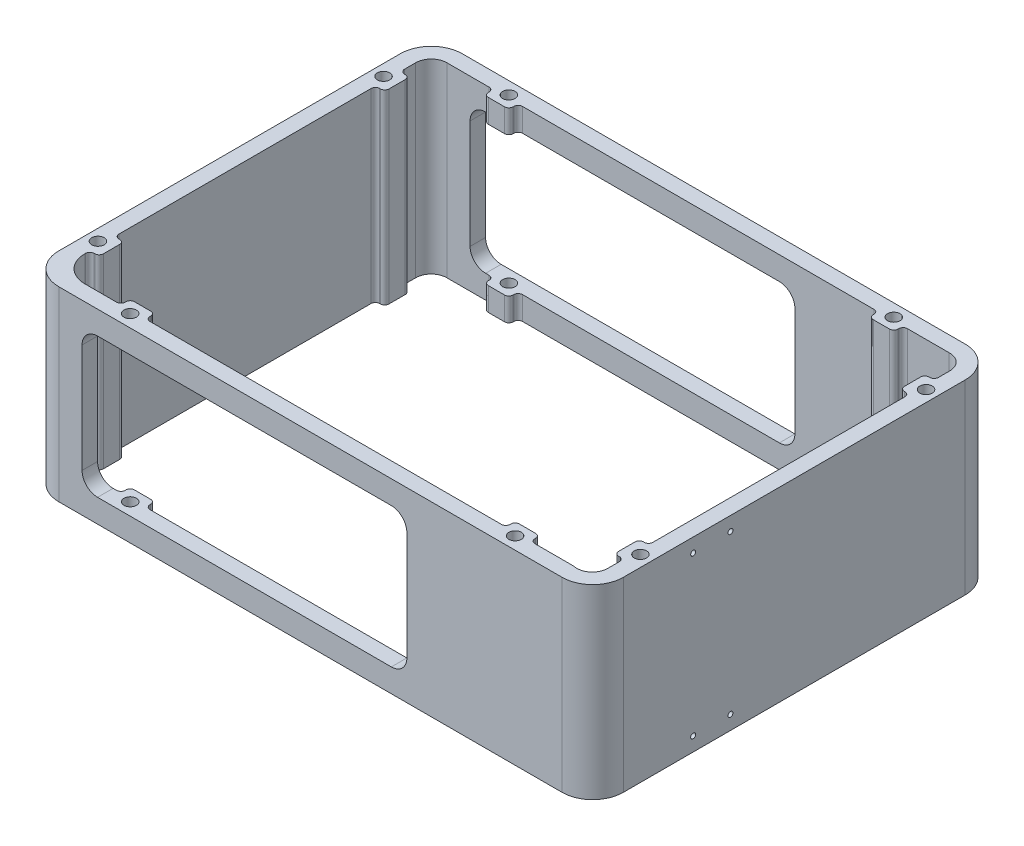
from build123d import *

# Parameters (mm, degrees)
SKETCH1_R           = 2
BOSS_EXTRUDE1_DEPTH = 60
CUT_EXTRUDE1_DEPTH  = 170.649638962
SKETCH3_R           = 0.8
CUT_EXTRUDE2_DEPTH  = 12


with BuildPart() as part:
    # Sketch1 → Boss-Extrude1 (new body)
    with BuildSketch(Plane(origin=(0, 0, 0), x_dir=(1, 0, 0), z_dir=(0, 1, 0))):
        with BuildLine():
            Line((91, 49.75), (91, -5.75))
            Line((91, -5.75), (91, -31.75))
            Line((91, -31.75), (91, -60.381931677))
            ThreePointArc((91, -60.381931677), (88.109485626, -67.360250682), (81.131166621, -70.250765056))
            Line((81.131166621, -70.250765056), (-81, -70.250765056))
            ThreePointArc((-81, -70.250765056), (-88.071067812, -67.321832868), (-91, -60.250765056))
            Line((-91, -60.250765056), (-91, 49.749234944))
            ThreePointArc((-91, 49.749234944), (-88.071067812, 56.820302755), (-81, 59.749234944))
            Line((-81, 59.749234944), (81.12369537, 59.749234944))
            ThreePointArc((81.12369537, 59.749234944), (88.11466632, 56.777198813), (91, 49.75))
        make_face()
        with Locations((-87.380604025, 40.749234944)):
            Circle(SKETCH1_R, mode=Mode.SUBTRACT)
        with Locations((-87.380604025, -51.250765056)):
            Circle(SKETCH1_R, mode=Mode.SUBTRACT)
        with Locations((-62, 55.749234944)):
            Circle(SKETCH1_R, mode=Mode.SUBTRACT)
        with Locations((-62, -66.250765056)):
            Circle(SKETCH1_R, mode=Mode.SUBTRACT)
        with Locations((62, -66.250765056)):
            Circle(SKETCH1_R, mode=Mode.SUBTRACT)
        with Locations((87.380604025, -51.250765056)):
            Circle(SKETCH1_R, mode=Mode.SUBTRACT)
        with Locations((87.380604025, 40.749234944)):
            Circle(SKETCH1_R, mode=Mode.SUBTRACT)
        with Locations((62, 55.749234944)):
            Circle(SKETCH1_R, mode=Mode.SUBTRACT)
        with BuildLine():
            Line((86, 49.75), (86, 46.137408821))
            ThreePointArc((86, 46.137408821), (85.593413285, 45.155821659), (84.611826122, 44.749234944))
            Line((84.611826122, 44.749234944), (84.388173878, 44.749234944))
            ThreePointArc((84.388173878, 44.749234944), (83.406586715, 44.342648228), (83, 43.361061066))
            Line((83, 43.361061066), (83, 38.141941201))
            ThreePointArc((83, 38.141941201), (83.408187843, 37.158755518), (84.392698858, 36.753774698))
            Line((84.392698858, 36.753774698), (84.607301142, 36.754474233))
            ThreePointArc((84.607301142, 36.754474233), (85.591812157, 36.349493414), (86, 35.366307731))
            Line((86, 35.366307731), (86, -5.75))
            Line((86, -5.75), (86, -45.862591179))
            ThreePointArc((86, -45.862591179), (85.593413285, -46.844178341), (84.611826122, -47.250765056))
            Line((84.611826122, -47.250765056), (84.388173878, -47.250765056))
            ThreePointArc((84.388173878, -47.250765056), (83.406586715, -47.657351772), (83, -48.638938934))
            Line((83, -48.638938934), (83, -53.862591179))
            ThreePointArc((83, -53.862591179), (83.406586715, -54.844178341), (84.388173878, -55.250765056))
            Line((84.388173878, -55.250765056), (84.611826122, -55.250765056))
            ThreePointArc((84.611826122, -55.250765056), (85.593413285, -55.657351772), (86, -56.638938934))
            Line((86, -56.638938934), (86, -60.381931677))
            ThreePointArc((86, -60.381931677), (84.107352551, -64.29911946), (79.86225595, -65.250765056))
            Line((79.86225595, -65.250765056), (67.388173878, -65.250765056))
            ThreePointArc((67.388173878, -65.250765056), (66.406586715, -64.844178341), (66, -63.862591179))
            Line((66, -63.862591179), (66, -63.638938934))
            ThreePointArc((66, -63.638938934), (65.593413285, -62.657351772), (64.611826122, -62.250765056))
            Line((64.611826122, -62.250765056), (59.388173878, -62.250765056))
            ThreePointArc((59.388173878, -62.250765056), (58.406586715, -62.657351772), (58, -63.638938934))
            Line((58, -63.638938934), (58, -63.862591179))
            ThreePointArc((58, -63.862591179), (57.593413285, -64.844178341), (56.611826122, -65.250765056))
            Line((56.611826122, -65.250765056), (-56.611826122, -65.250765056))
            ThreePointArc((-56.611826122, -65.250765056), (-57.593413285, -64.844178341), (-58, -63.862591179))
            Line((-58, -63.862591179), (-58, -63.638938934))
            ThreePointArc((-58, -63.638938934), (-58.406586715, -62.657351772), (-59.388173878, -62.250765056))
            Line((-59.388173878, -62.250765056), (-64.611826122, -62.250765056))
            ThreePointArc((-64.611826122, -62.250765056), (-65.593413285, -62.657351772), (-66, -63.638938934))
            Line((-66, -63.638938934), (-66, -63.862591179))
            ThreePointArc((-66, -63.862591179), (-66.406586715, -64.844178341), (-67.388173878, -65.250765056))
            Line((-67.388173878, -65.250765056), (-77.619954017, -65.250765056))
            ThreePointArc((-77.619954017, -65.250765056), (-83.545541358, -62.796306415), (-86, -56.870719073))
            Line((-86, -56.870719073), (-86, -56.638938934))
            ThreePointArc((-86, -56.638938934), (-85.593413285, -55.657351772), (-84.611826122, -55.250765056))
            Line((-84.611826122, -55.250765056), (-84.388173878, -55.250765056))
            ThreePointArc((-84.388173878, -55.250765056), (-83.406586715, -54.844178341), (-83, -53.862591179))
            Line((-83, -53.862591179), (-83, -48.638938934))
            ThreePointArc((-83, -48.638938934), (-83.406586715, -47.657351772), (-84.388173878, -47.250765056))
            Line((-84.388173878, -47.250765056), (-84.611826122, -47.250765056))
            ThreePointArc((-84.611826122, -47.250765056), (-85.593413285, -46.844178341), (-86, -45.862591179))
            Line((-86, -45.862591179), (-86, 35.361061066))
            ThreePointArc((-86, 35.361061066), (-85.593413285, 36.342648228), (-84.611826122, 36.749234944))
            Line((-84.611826122, 36.749234944), (-84.388173878, 36.749234944))
            ThreePointArc((-84.388173878, 36.749234944), (-83.406586715, 37.155821659), (-83, 38.137408821))
            Line((-83, 38.137408821), (-83, 43.361061066))
            ThreePointArc((-83, 43.361061066), (-83.406586715, 44.342648228), (-84.388173878, 44.749234944))
            Line((-84.388173878, 44.749234944), (-84.611826122, 44.749234944))
            ThreePointArc((-84.611826122, 44.749234944), (-85.593413285, 45.155821659), (-86, 46.137408821))
            Line((-86, 46.137408821), (-86, 49.744753335))
            ThreePointArc((-86, 49.744753335), (-84.537119338, 53.283184717), (-81, 54.749234944))
            Line((-81, 54.749234944), (-67.388173878, 54.749234944))
            ThreePointArc((-67.388173878, 54.749234944), (-66.406586715, 54.342648228), (-66, 53.361061066))
            Line((-66, 53.361061066), (-66, 53.137408821))
            ThreePointArc((-66, 53.137408821), (-65.593413285, 52.155821659), (-64.611826122, 51.749234944))
            Line((-64.611826122, 51.749234944), (-59.388173878, 51.749234944))
            ThreePointArc((-59.388173878, 51.749234944), (-58.406586715, 52.155821659), (-58, 53.137408821))
            Line((-58, 53.137408821), (-58, 53.361061066))
            ThreePointArc((-58, 53.361061066), (-57.593413285, 54.342648228), (-56.611826122, 54.749234944))
            Line((-56.611826122, 54.749234944), (56.611826122, 54.749234944))
            ThreePointArc((56.611826122, 54.749234944), (57.593413285, 54.342648228), (58, 53.361061066))
            Line((58, 53.361061066), (58, 53.137408821))
            ThreePointArc((58, 53.137408821), (58.406586715, 52.155821659), (59.388173878, 51.749234944))
            Line((59.388173878, 51.749234944), (64.611826122, 51.749234944))
            ThreePointArc((64.611826122, 51.749234944), (65.593413285, 52.155821659), (66, 53.137408821))
            Line((66, 53.137408821), (66, 53.361061066))
            ThreePointArc((66, 53.361061066), (66.406586715, 54.342648228), (67.388173878, 54.749234944))
            Line((67.388173878, 54.749234944), (80.771004103, 54.749234944))
            ThreePointArc((80.771004103, 54.749234944), (84.455244107, 53.368524041), (86, 49.75))
        make_face(mode=Mode.SUBTRACT)
    extrude(amount=BOSS_EXTRUDE1_DEPTH)

    # Sketch2 → Cut-Extrude1 (cut, through all)
    with BuildSketch(Plane.XY.offset(70.250765056)):
        with BuildLine():
            Line((-68.5, 7.5), (26.131166621, 7.5))
            ThreePointArc((26.131166621, 7.5), (29.666700527, 8.964466094), (31.131166621, 12.5))
            Line((31.131166621, 12.5), (31.131166621, 47.5))
            ThreePointArc((31.131166621, 47.5), (29.666700527, 51.035533906), (26.131166621, 52.5))
            Line((26.131166621, 52.5), (-68.5, 52.5))
            ThreePointArc((-68.5, 52.5), (-72.035533906, 51.035533906), (-73.5, 47.5))
            Line((-73.5, 47.5), (-73.5, 12.5))
            ThreePointArc((-73.5, 12.5), (-72.035533906, 8.964466094), (-68.5, 7.5))
        make_face()
    extrude(amount=-CUT_EXTRUDE1_DEPTH, mode=Mode.SUBTRACT)

    # Sketch3 → Cut-Extrude2 (cut)
    with BuildSketch(Plane(origin=(91, 0, 0), x_dir=(0, 0, -1), z_dir=(1, 0, 0))):
        with Locations((-37.881931677, 55.5)):
            Circle(SKETCH3_R)
        with Locations((-25.881931677, 55.5)):
            Circle(SKETCH3_R)
        with Locations((-25.881931677, 4.5)):
            Circle(SKETCH3_R)
        with Locations((-37.881931677, 4.5)):
            Circle(SKETCH3_R)
    extrude(amount=-CUT_EXTRUDE2_DEPTH, mode=Mode.SUBTRACT)


solid = part.part
